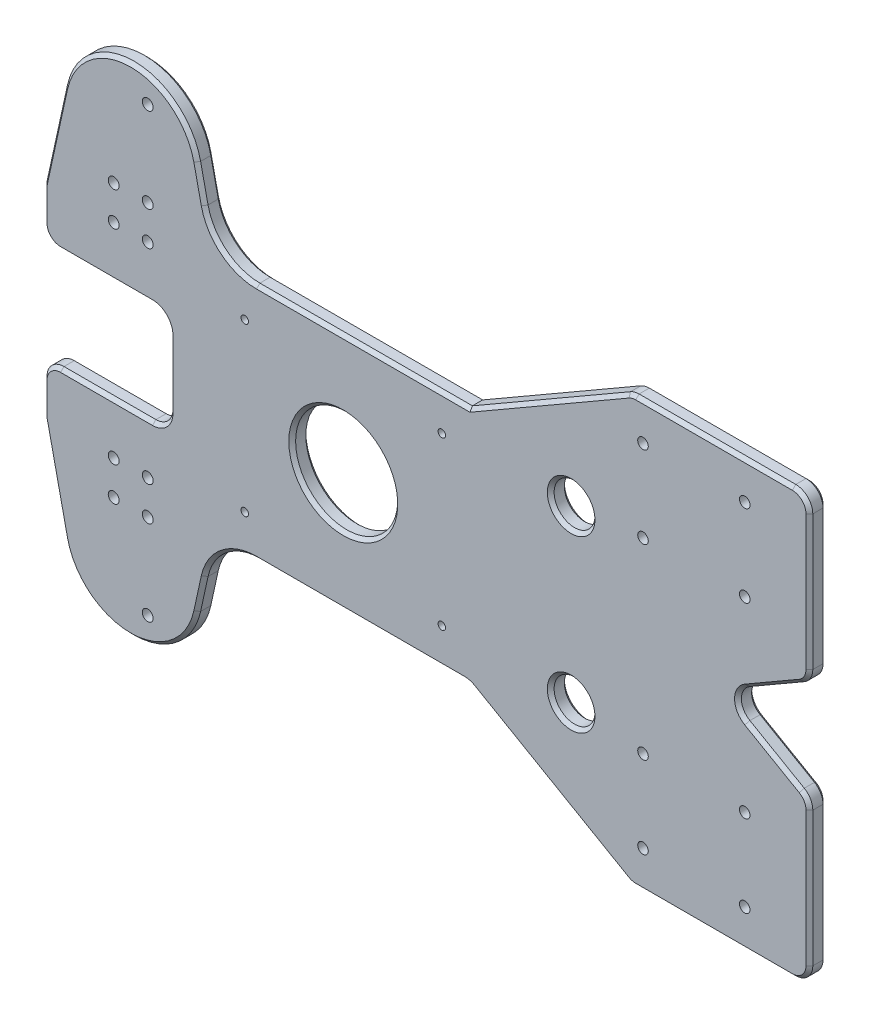
from build123d import *

# Parameters (mm, degrees)
EXTRUDE_1_DEPTH     = 2.5
SKETCH_2_R          = 1.6
CUT_EXTRUDE_1_DEPTH = 145.841292455
SKETCH_4_R          = 1.1
SKETCH_4_R_2        = 15
SKETCH_4_R_3        = 6
CUT_EXTRUDE_3_DEPTH = 145.841292455
CHAMFER_1_SIZE      = 1
CHAMFER_2_SIZE      = 1
HOLE_WIZARD_M3_1_D  = 3.1


with BuildPart() as part:
    # 草图1 → 凸台-拉伸1 (new, symmetric)
    with BuildSketch(Plane.XY):
        with BuildLine():
            Line((-125, 29), (-125, 20))
            ThreePointArc((-125, 20), (-123.535533906, 16.464466094), (-120, 15))
            Line((-120, 15), (-93, 15))
            ThreePointArc((-93, 15), (-89.464466094, 13.535533906), (-88, 10))
            Line((-88, 10), (-88, -10))
            ThreePointArc((-88, -10), (-89.464466094, -13.535533906), (-93, -15))
            Line((-93, -15), (-120, -15))
            ThreePointArc((-120, -15), (-123.535533906, -16.464466094), (-125, -20))
            Line((-125, -20), (-125, -29))
            ThreePointArc((-125, -29), (-124.97111946, -29.536629587), (-124.884811475, -30.067059913))
            Line((-124.884811475, -30.067059913), (-118.942864965, -57.268239653))
            ThreePointArc((-118.942864965, -57.268239653), (-99.403619067, -73), (-79.864373169, -57.268239653))
            Line((-79.864373169, -57.268239653), (-77.679928756, -47.268239653))
            ThreePointArc((-77.679928756, -47.268239653), (-72.223696204, -38.448239826), (-62.442463525, -35))
            Line((-62.442463525, -35), (-1.339745962, -35))
            ThreePointArc((-1.339745962, -35), (-0.045650737, -35.170370869), (1.160254038, -35.669872981))
            Line((1.160254038, -35.669872981), (46.47114317, -61.830127019))
            ThreePointArc((46.47114317, -61.830127019), (47.677047945, -62.329629131), (48.97114317, -62.5))
            Line((48.97114317, -62.5), (95, -62.5))
            ThreePointArc((95, -62.5), (98.535533906, -61.035533906), (100, -57.5))
            Line((100, -57.5), (100, -17.886751346))
            ThreePointArc((100, -17.886751346), (99.330127019, -15.386751346), (97.5, -13.556624327))
            Line((97.5, -13.556624327), (81.519237886, -4.330127019))
            ThreePointArc((81.519237886, -4.330127019), (79.019237886, 0), (81.519237886, 4.330127019))
            Line((81.519237886, 4.330127019), (97.5, 13.556624327))
            ThreePointArc((97.5, 13.556624327), (99.330127019, 15.386751346), (100, 17.886751346))
            Line((100, 17.886751346), (100, 57.5))
            ThreePointArc((100, 57.5), (98.535533906, 61.035533906), (95, 62.5))
            Line((95, 62.5), (48.97114317, 62.5))
            ThreePointArc((48.97114317, 62.5), (47.677047945, 62.329629131), (46.47114317, 61.830127019))
            Line((46.47114317, 61.830127019), (0, 35))
            Line((0, 35), (-62.442463525, 35))
            ThreePointArc((-62.442463525, 35), (-72.223696204, 38.448239826), (-77.679928756, 47.268239653))
            Line((-77.679928756, 47.268239653), (-79.864373169, 57.268239653))
            ThreePointArc((-79.864373169, 57.268239653), (-99.403619067, 73), (-118.942864965, 57.268239653))
            Line((-118.942864965, 57.268239653), (-124.884811475, 30.067059913))
            ThreePointArc((-124.884811475, 30.067059913), (-124.97111946, 29.536629587), (-125, 29))
        make_face()
    extrude(amount=EXTRUDE_1_DEPTH, both=True)

    # 草图2 → 切除-拉伸1 (cut, through all)
    with BuildSketch(Plane.XY.offset(2.5)):
        with Locations((-104.403619067, 40)):
            Circle(SKETCH_2_R)
        with Locations((-94.403619067, 40)):
            Circle(SKETCH_2_R)
        with Locations((-94.403619067, -40)):
            Circle(SKETCH_2_R)
        with Locations((-104.403619067, -40)):
            Circle(SKETCH_2_R)
        with Locations((-104.403619067, 30)):
            Circle(SKETCH_2_R)
        with Locations((-94.403619067, 30)):
            Circle(SKETCH_2_R)
        with Locations((-94.403619067, -30)):
            Circle(SKETCH_2_R)
        with Locations((-104.403619067, -30)):
            Circle(SKETCH_2_R)
        with Locations((-94.403619067, 65)):
            Circle(SKETCH_2_R)
        with Locations((-94.403619067, -65)):
            Circle(SKETCH_2_R)
    extrude(amount=-CUT_EXTRUDE_1_DEPTH, mode=Mode.SUBTRACT)

    # 草图4 → 切除-拉伸3 (cut, through all)
    with BuildSketch(Plane.XY.offset(2.5)):
        with Locations((-65.894, 24.476)):
            Circle(SKETCH_4_R)
        with Locations((-65.894, -24.476)):
            Circle(SKETCH_4_R)
        with Locations((-8, -24.476)):
            Circle(SKETCH_4_R)
        with Locations((-8, 24.476)):
            Circle(SKETCH_4_R)
        with Locations((-36.947, 0)):
            Circle(SKETCH_4_R_2)
        with Locations((30, 25)):
            Circle(SKETCH_4_R_3)
        with Locations((30, -25)):
            Circle(SKETCH_4_R_3)
    extrude(amount=-CUT_EXTRUDE_3_DEPTH, mode=Mode.SUBTRACT)

    # 倒角1
    chamfer_1_edges = [part.edges().sort_by_distance(p)[0] for p in [
        (23.235571585, 48.415063509, -2.5),
        (47.677047945, 62.329629131, -2.5),
        (71.985571585, 62.5, -2.5),
        (98.535533906, 61.035533906, -2.5),
        (-31.221231763, 35, -2.5),
        (100, 37.693375673, -2.5),
        (-72.223696204, 38.448239826, -2.5),
        (99.330127019, 15.386751346, -2.5),
        (-78.772150962, 52.268239653, -2.5),
        (89.509618943, 8.943375673, -2.5),
        (79.019237886, 0, -2.5),
        (89.509618943, -8.943375673, -2.5),
        (99.330127019, -15.386751346, -2.5),
        (-125, 24.5, -2.5),
        (100, -37.693375673, -2.5),
        (-123.535533906, 16.464466094, -2.5),
        (98.535533906, -61.035533906, -2.5),
        (-106.5, 15, -2.5),
        (71.985571585, -62.5, -2.5),
        (-89.464466094, 13.535533906, -2.5),
        (47.677047945, -62.329629131, -2.5),
        (-88, 0, -2.5),
        (23.815698604, -48.75, -2.5),
        (-89.464466094, -13.535533906, -2.5),
        (-0.045650737, -35.170370869, -2.5),
        (-106.5, -15, -2.5),
        (-31.891104744, -35, -2.5),
        (-123.535533906, -16.464466094, -2.5),
        (-72.223696204, -38.448239826, -2.5),
        (-125, -24.5, -2.5),
        (-78.772150962, -52.268239653, -2.5),
        (23.235571585, 48.415063509, 2.5),
        (47.677047945, 62.329629131, 2.5),
        (71.985571585, 62.5, 2.5),
        (98.535533906, 61.035533906, 2.5),
        (100, 37.693375673, 2.5),
        (99.330127019, 15.386751346, 2.5),
        (89.509618943, 8.943375673, 2.5),
        (79.019237886, 0, 2.5),
        (89.509618943, -8.943375673, 2.5),
        (99.330127019, -15.386751346, 2.5),
        (100, -37.693375673, 2.5),
        (98.535533906, -61.035533906, 2.5),
        (71.985571585, -62.5, 2.5),
        (47.677047945, -62.329629131, 2.5),
        (23.815698604, -48.75, 2.5),
        (-0.045650737, -35.170370869, 2.5),
        (-31.891104744, -35, 2.5),
        (-72.223696204, -38.448239826, 2.5),
        (-78.772150962, -52.268239653, 2.5),
        (-125, -24.5, 2.5),
        (-123.535533906, -16.464466094, 2.5),
        (-31.221231763, 35, 2.5),
        (-106.5, -15, 2.5),
        (-72.223696204, 38.448239826, 2.5),
        (-89.464466094, -13.535533906, 2.5),
        (-78.772150962, 52.268239653, 2.5),
        (-88, 0, 2.5),
        (-89.464466094, 13.535533906, 2.5),
        (-106.5, 15, 2.5),
        (-123.535533906, 16.464466094, 2.5),
        (-125, 24.5, 2.5),
        (-121.91383822, 43.667649783, -2.5),
        (-124.97111946, 29.536629587, -2.5),
        (-124.97111946, -29.536629587, -2.5),
        (-121.91383822, -43.667649783, -2.5),
        (-121.91383822, -43.667649783, 2.5),
        (-124.97111946, -29.536629587, 2.5),
        (-121.91383822, 43.667649783, 2.5),
        (-124.97111946, 29.536629587, 2.5),
        (-99.403619067, -73, 2.5),
        (-99.403619067, 73, 2.5),
        (-99.403619067, 73, -2.5),
        (-99.403619067, -73, -2.5),
    ]]
    chamfer(chamfer_1_edges, length=CHAMFER_1_SIZE)

    # 倒角2
    chamfer_2_edges = [part.edges().sort_by_distance(p)[0] for p in [
        (-51.947, 0, 2.5),
        (-51.947, 0, -2.5),
        (24, 25, -2.5),
        (24, -25, -2.5),
        (24, -25, 2.5),
        (24, 25, 2.5),
    ]]
    chamfer(chamfer_2_edges, length=CHAMFER_2_SIZE)

    # M3 螺旋的螺纹孔钻头1 (through all)
    with Locations(Plane(origin=(81, -27.44, -2.5), x_dir=(-1, 0, 0), z_dir=(0, 0, -1))):
        with Locations((0, 0), (29.89, 0), (29.89, -24.06), (0, -24.06)):
            hole_wizard_m3_1 = Hole(HOLE_WIZARD_M3_1_D / 2)

    # 镜向1: M3 螺旋的螺纹孔钻头1 across plane
    add(hole_wizard_m3_1.mirror(Plane.ZX), mode=Mode.SUBTRACT)


solid = part.part
